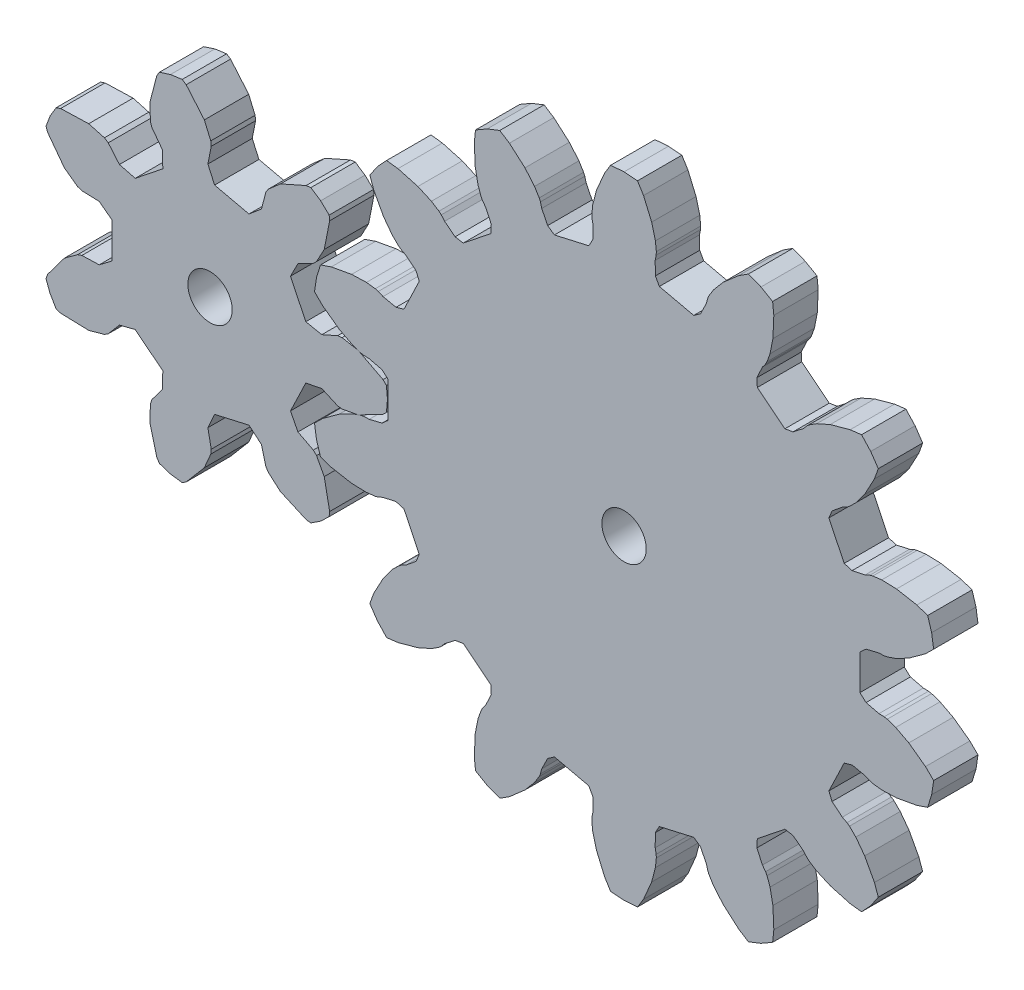
from build123d import *

# Parameters (mm, degrees)
MODEL_R             = 2.38125
BOSS_EXTRUDE2_DEPTH = 4.7625
MODEL_4_R           = 2.38125
BOSS_EXTRUDE3_DEPTH = 4.7625


with BuildPart() as part:
    # Model → Boss-Extrude2 (new body)
    with BuildSketch(Plane.XY):
        Polygon((10.317668308, -15.528627526), (10.823987774, -15.589294349), (11.877480725, -14.893889741), (12.789874323, -14.021552141), (12.843395225, -13.514427523), (12.262307132, -10.557590207), (11.434203924, -9.01713335), (11.089226134, -8.67698646), (9.440106563, -7.820222311), (8.639123878, -6.261194238), (10.281604408, -2.850548274), (11.999906173, -2.50474365), (13.697960592, -3.259893539), (14.178988273, -3.317529919), (15.863202798, -3.01114371), (15.932580395, -2.987415175), (18.573730848, -1.61526299), (18.936847104, -1.257231637), (19.05, 0), (18.936847104, 1.257231637), (18.573730848, 1.61526299), (15.932580395, 2.987415175), (15.863202798, 3.01114371), (14.178988273, 3.317529919), (13.697960592, 3.259893539), (11.999906173, 2.50474365), (10.281604408, 2.850548274), (8.639123878, 6.261194238), (9.440106563, 7.820222311), (11.089226134, 8.67698646), (11.434203924, 9.01713335), (12.262307132, 10.557590207), (12.843395225, 13.514427523), (12.789874323, 14.021552141), (11.877480725, 14.893889741), (10.823987774, 15.589294349), (10.317668308, 15.528627526), (7.564269343, 14.304150324), (6.246705254, 13.154025494), (5.991851337, 12.742007213), (5.523531681, 10.943586555), (4.181827113, 9.815769795), (0.491206862, 10.658129784), (-0.228285832, 12.256401368), (0.130078218, 14.079918676), (0.079230805, 14.56171129), (-0.608832959, 16.16960759), (-2.558278961, 18.467478467), (-2.988134689, 18.741821169), (-4.239023792, 18.572376727), (-5.439555119, 18.182300453), (-5.70780891, 17.748618808), (-6.46719026, 14.832475765), (-6.389474231, 13.085271578), (-6.226244186, 12.629129567), (-5.112174826, 11.141685575), (-5.066951293, 9.389516455), (-8.02659894, 7.029276216), (-9.724774339, 7.46326021), (-10.92702125, 8.880384951), (-11.335404727, 9.141023624), (-13.021509414, 9.605580658), (-16.033516909, 9.514141457), (-16.516017334, 9.349116593), (-17.163456933, 8.26548523), (-17.607002061, 7.083663464), (-17.435189601, 6.603538122), (-15.62872369, 4.191644428), (-14.214249299, 3.163041273), (-13.755850845, 3.006259769), (-11.89830942, 2.949868109), (-10.500212027, 1.892765714), (-10.500212027, -1.892765714), (-11.89830942, -2.949868109), (-13.755850845, -3.006259769), (-14.214249299, -3.163041273), (-15.62872369, -4.191644428), (-17.435189601, -6.603538122), (-17.607002061, -7.083663464), (-17.163456933, -8.26548523), (-16.516017334, -9.349116593), (-16.033516909, -9.514141457), (-13.021509414, -9.605580658), (-11.335404727, -9.141023624), (-10.92702125, -8.880384951), (-9.724774339, -7.46326021), (-8.02659894, -7.029276216), (-5.066951293, -9.389516455), (-5.112174826, -11.141685575), (-6.226244186, -12.629129567), (-6.389474231, -13.085271578), (-6.46719026, -14.832475765), (-5.70780891, -17.748618808), (-5.439555119, -18.182300453), (-4.239023792, -18.572376727), (-2.988134689, -18.741821169), (-2.558278961, -18.467478467), (-0.608832959, -16.16960759), (0.079230805, -14.56171129), (0.130078218, -14.079918676), (-0.228285832, -12.256401368), (0.491206862, -10.658129784), (4.181827113, -9.815769795), (5.523531681, -10.943586555), (5.991851337, -12.742007213), (6.246705254, -13.154025494), (7.564269343, -14.304150324), align=None)
        Circle(MODEL_R, mode=Mode.SUBTRACT)
    extrude(amount=BOSS_EXTRUDE2_DEPTH)


with BuildPart() as body_2:
    # Model<4> → Boss-Extrude3 (new body)
    with BuildSketch(Plane.XY):
        Polygon((15.932580395, -2.987415175), (15.863202798, -3.01114371), (15.295119363, -3.205439688), (13.885759197, -3.937642061), (12.092814379, -5.241468208), (11.216781635, -6.105233418), (11.432441374, -7.536042296), (11.858943369, -8.918727806), (13.022995277, -9.316857006), (15.204091704, -9.713634172), (16.791572041, -9.761827257), (17.744288084, -9.647673527), (18.063252407, -9.559792199), (18.573410138, -9.332917518), (19.968705688, -9.03480005), (20.819040198, -9.279259008), (22.461520729, -12.689904973), (22.122471543, -13.507140931), (21.019441375, -14.412153718), (20.523985464, -14.669557044), (20.256406073, -14.864140281), (19.573148356, -15.537829991), (18.621049426, -16.809019993), (17.571370927, -18.761656362), (17.156866376, -19.919978287), (17.971973793, -21.115521289), (18.956163572, -22.176225607), (20.177679888, -22.029864427), (22.314935027, -21.441006028), (23.766115584, -20.795644593), (24.574953632, -20.279427637), (24.824200278, -20.061855863), (25.185399276, -19.636099695), (26.313168806, -18.762109087), (27.185360495, -18.613412681), (30.145008142, -20.97365292), (30.194120775, -21.857065005), (29.592995265, -23.151040205), (29.258288032, -23.597922851), (29.101633833, -23.889334637), (28.778342911, -24.792762505), (28.472080088, -26.351165365), (28.373569608, -28.565868377), (28.50269096, -29.789327155), (29.755804035, -30.512812326), (31.102750741, -31.041449953), (32.139795177, -30.37958702), (33.809899436, -28.921723684), (34.837356108, -27.710629476), (35.342115865, -26.894592393), (35.472278478, -26.590422931), (35.612978853, -26.050111506), (36.249853776, -24.773352317), (36.971154382, -24.260951694), (40.661774633, -25.103311682), (41.089321724, -25.877929295), (41.109161152, -27.30457925), (41.001495468, -27.852430628), (40.986793747, -28.182953284), (41.087501353, -29.137184342), (41.487733744, -30.674139262), (42.359902492, -32.712259822), (43.00707568, -33.758534437), (44.449999999, -33.866666666), (45.892924318, -33.758534437), (46.540097506, -32.712259822), (47.412266254, -30.674139262), (47.812498645, -29.137184342), (47.913206251, -28.182953284), (47.89850453, -27.852430628), (47.790838846, -27.30457925), (47.810678274, -25.877929295), (48.238225365, -25.103311682), (51.928845616, -24.260951694), (52.650146222, -24.773352317), (53.287021145, -26.050111506), (53.42772152, -26.590422931), (53.557884133, -26.894592393), (54.06264389, -27.710629476), (55.090100562, -28.921723684), (56.760204821, -30.37958702), (57.797249257, -31.041449953), (59.144195964, -30.512812326), (60.397309038, -29.789327155), (60.526430391, -28.565868377), (60.427919911, -26.351165365), (60.121657087, -24.792762505), (59.798366166, -23.889334637), (59.641711967, -23.597922851), (59.307004733, -23.151040205), (58.705879223, -21.857065005), (58.754991856, -20.97365292), (61.714639503, -18.613412681), (62.586831192, -18.762109087), (63.714600722, -19.636099695), (64.07579972, -20.061855863), (64.325046366, -20.279427637), (65.133884414, -20.795644593), (66.585064971, -21.441006028), (68.72232011, -22.029864427), (69.943836426, -22.176225607), (70.928026205, -21.115521289), (71.743133622, -19.919978287), (71.328629071, -18.761656362), (70.278950572, -16.809019993), (69.326851643, -15.537829991), (68.643593925, -14.864140281), (68.376014534, -14.669557044), (67.880558623, -14.412153718), (66.777528455, -13.507140931), (66.43847927, -12.689904973), (68.0809598, -9.279259008), (68.93129431, -9.03480005), (70.32658986, -9.332917518), (70.836747591, -9.559792199), (71.155711914, -9.647673527), (72.108427957, -9.761827257), (73.695908294, -9.713634172), (75.877004721, -9.316857006), (77.041056629, -8.918727806), (77.467558624, -7.536042296), (77.683218363, -6.105233418), (76.80718562, -5.241468208), (75.014240801, -3.937642061), (73.604880636, -3.205439688), (72.696983693, -2.894920646), (72.371476489, -2.835705554), (71.813403021, -2.818763434), (70.426936847, -2.481961942), (69.766878693, -1.892765714), (69.766878693, 1.892765714), (70.426936847, 2.481961942), (71.813403021, 2.818763434), (72.371476489, 2.835705554), (72.696983693, 2.894920646), (73.604880636, 3.205439688), (75.014240801, 3.937642061), (76.80718562, 5.241468208), (77.683218363, 6.105233418), (77.467558624, 7.536042296), (77.041056629, 8.918727806), (75.877004721, 9.316857006), (73.695908294, 9.713634172), (72.108427957, 9.761827257), (71.155711914, 9.647673527), (70.836747591, 9.559792199), (70.32658986, 9.332917518), (68.93129431, 9.03480005), (68.0809598, 9.279259008), (66.43847927, 12.689904973), (66.777528455, 13.507140931), (67.880558623, 14.412153718), (68.376014534, 14.669557044), (68.643593925, 14.864140281), (69.326851643, 15.537829991), (70.278950572, 16.809019993), (71.328629071, 18.761656362), (71.743133622, 19.919978287), (70.928026205, 21.115521289), (69.943836426, 22.176225607), (68.72232011, 22.029864427), (66.585064971, 21.441006028), (65.133884414, 20.795644593), (64.325046366, 20.279427637), (64.07579972, 20.061855863), (63.714600722, 19.636099695), (62.586831192, 18.762109087), (61.714639503, 18.613412681), (58.754991856, 20.97365292), (58.705879223, 21.857065005), (59.307004733, 23.151040205), (59.641711967, 23.597922851), (59.798366166, 23.889334637), (60.121657087, 24.792762505), (60.427919911, 26.351165365), (60.526430391, 28.565868377), (60.397309038, 29.789327155), (59.144195964, 30.512812326), (57.797249257, 31.041449953), (56.760204821, 30.37958702), (55.090100562, 28.921723684), (54.06264389, 27.710629476), (53.557884133, 26.894592393), (53.42772152, 26.590422931), (53.287021145, 26.050111506), (52.650146222, 24.773352317), (51.928845616, 24.260951694), (48.238225365, 25.103311682), (47.810678274, 25.877929295), (47.790838846, 27.30457925), (47.89850453, 27.852430628), (47.913206251, 28.182953284), (47.812498645, 29.137184342), (47.412266254, 30.674139262), (46.540097506, 32.712259822), (45.892924318, 33.758534437), (44.449999999, 33.866666666), (43.00707568, 33.758534437), (42.359902492, 32.712259822), (41.487733744, 30.674139262), (41.087501353, 29.137184342), (40.986793747, 28.182953284), (41.001495468, 27.852430628), (41.109161152, 27.30457925), (41.089321724, 25.877929295), (40.661774633, 25.103311682), (36.971154382, 24.260951694), (36.249853776, 24.773352317), (35.612978853, 26.050111506), (35.472278478, 26.590422931), (35.342115865, 26.894592393), (34.837356108, 27.710629476), (33.809899436, 28.921723684), (32.139795177, 30.37958702), (31.102750741, 31.041449953), (29.755804035, 30.512812326), (28.50269096, 29.789327155), (28.373569608, 28.565868377), (28.472080088, 26.351165365), (28.778342911, 24.792762505), (29.101633833, 23.889334637), (29.258288032, 23.597922851), (29.592995265, 23.151040205), (30.194120775, 21.857065005), (30.145008142, 20.97365292), (27.185360495, 18.613412681), (26.313168806, 18.762109087), (25.185399276, 19.636099695), (24.824200278, 20.061855863), (24.574953632, 20.279427637), (23.766115584, 20.795644593), (22.314935027, 21.441006028), (20.177679888, 22.029864427), (18.956163572, 22.176225607), (17.971973793, 21.115521289), (17.156866376, 19.919978287), (17.571370927, 18.761656362), (18.621049426, 16.809019993), (19.573148356, 15.537829991), (20.256406073, 14.864140281), (20.523985464, 14.669557044), (21.019441375, 14.412153718), (22.122471543, 13.507140931), (22.461520729, 12.689904973), (20.819040198, 9.279259008), (19.968705688, 9.03480005), (18.573410138, 9.332917518), (18.063252407, 9.559792199), (17.744288084, 9.647673527), (16.791572041, 9.761827257), (15.204091704, 9.713634172), (13.022995277, 9.316857006), (11.858943369, 8.918727806), (11.432441374, 7.536042296), (11.216781635, 6.105233418), (12.092814379, 5.241468208), (13.885759197, 3.937642061), (15.295119363, 3.205439688), (15.863202798, 3.01114371), (15.932580395, 2.987415175), (16.203016305, 2.894920646), (16.528523509, 2.835705554), (17.086596977, 2.818763434), (18.473063151, 2.481961942), (19.133121305, 1.892765714), (19.133121305, -1.892765714), (18.473063151, -2.481961942), (17.086596977, -2.818763434), (16.528523509, -2.835705554), (16.203016305, -2.894920646), align=None)
        with Locations((44.449999999, 0)):
            Circle(MODEL_4_R, mode=Mode.SUBTRACT)
    extrude(amount=BOSS_EXTRUDE3_DEPTH)


solid = Compound([part.part, body_2.part])
